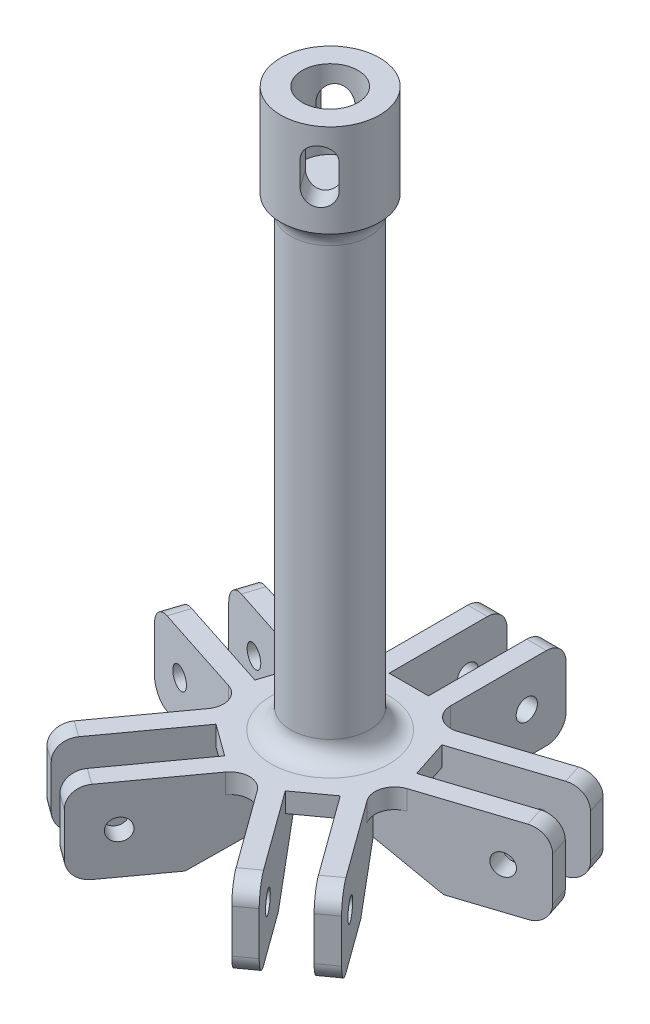
from build123d import *

# Parameters (mm, degrees)
BOSS_EXTRUDE1_DEPTH     = 3.175
SKETCH2_W               = 3.175
SKETCH2_H               = 13.97
BOSS_EXTRUDE2_DEPTH     = 10.16
FILLET1_R               = 3.175
SKETCH3_R               = 6.35
BOSS_EXTRUDE3_DEPTH     = 90
SKETCH4_R               = 1.7145
CUT_EXTRUDE1_DEPTH      = 106.700200906
CIRPATTERN2_COUNT       = 5
SKETCH5_R               = 4.5
CUT_EXTRUDE2_DEPTH      = 12.7
FILLET2_R               = 3.175
CHAMFER1_SIZE           = 3.175
SKETCH6_W               = 6.35
SKETCH6_H               = 5.08
CUT_EXTRUDE3_DEPTH      = 101.708584079
BOSS_EXTRUDE4_DEPTH     = 3.175
BOSS_EXTRUDE5_DEPTH     = 3.175
CIRPATTERN3_COUNT       = 5
BOSS_EXTRUDE6_START     = -15
SKETCH10_R              = 8
SKETCH10_R_2            = 6.35
BOSS_EXTRUDE6_DEPTH     = 15
FILLET3_R               = 3.175
CUT_EXTRUDE6_DEPTH      = 112.317109798
CUT_EXTRUDE6_DEPTH_BACK = 112.317109798


# Some blends are built 0.0001 mm under size
with BuildPart() as part:
    # Sketch1 → Boss-Extrude1 (new body)
    with BuildSketch(Plane(origin=(0, 0, 0), x_dir=(1, 0, 0), z_dir=(0, 1, 0))):
        with BuildLine():
            Line((3.175, 17.78), (-3.175, 17.78))
            Line((-3.175, 17.78), (-3.175, 31.75))
            Line((-3.175, 31.75), (-6.35, 31.75))
            Line((-6.35, 31.75), (-6.35, 17.78))
            Line((-6.35, 17.78), (-6.35, 17.48005039))
            Line((-6.35, 17.48005039), (-6.35, 13.110037792))
            ThreePointArc((-6.35, 13.110037792), (-7.658781824, 10.541408835), (-10.506128957, 10.090433353))
            Line((-10.506128957, 10.090433353), (-14.662257914, 11.440841512))
            Line((-14.662257914, 11.440841512), (-18.571052273, 12.710885787))
            Line((-18.571052273, 12.710885787), (-28.233786478, 15.85049845))
            Line((-28.233786478, 15.85049845), (-29.214915435, 12.830894011))
            Line((-29.214915435, 12.830894011), (-15.928655903, 8.513926599))
            Line((-15.928655903, 8.513926599), (-17.890913817, 2.474717721))
            Line((-17.890913817, 2.474717721), (-31.17717335, 6.791685132))
            Line((-31.17717335, 6.791685132), (-32.158302307, 3.772080693))
            Line((-32.158302307, 3.772080693), (-20.07988455, -0.152435136))
            Line((-20.07988455, -0.152435136), (-18.586773743, -0.637576245))
            Line((-18.586773743, -0.637576245), (-14.430644786, -1.987984404))
            ThreePointArc((-14.430644786, -1.987984404), (-12.392169304, -4.026459886), (-12.843144786, -6.873807019))
            Line((-12.843144786, -6.873807019), (-15.411773743, -10.409221476))
            Line((-15.411773743, -10.409221476), (-17.827541511, -13.734240556))
            Line((-17.827541511, -13.734240556), (-23.799439675, -21.953853219))
            Line((-23.799439675, -21.953853219), (-21.230810717, -23.820071395))
            Line((-21.230810717, -23.820071395), (-13.019450743, -12.518103984))
            Line((-13.019450743, -12.518103984), (-7.882192829, -16.250540336))
            Line((-7.882192829, -16.250540336), (-16.093552803, -27.552507747))
            Line((-16.093552803, -27.552507747), (-13.524923846, -29.418725923))
            Line((-13.524923846, -29.418725923), (-6.060051142, -19.144210095))
            Line((-6.060051142, -19.144210095), (-5.137257914, -17.87409418))
            Line((-5.137257914, -17.87409418), (-2.568628957, -14.338679723))
            ThreePointArc((-2.568628957, -14.338679723), (0, -13.029897899), (2.568628957, -14.338679723))
            Line((2.568628957, -14.338679723), (5.137257914, -17.87409418))
            Line((5.137257914, -17.87409418), (7.553025683, -21.199113261))
            Line((7.553025683, -21.199113261), (13.524923846, -29.418725923))
            Line((13.524923846, -29.418725923), (16.093552803, -27.552507747))
            Line((16.093552803, -27.552507747), (7.882192829, -16.250540336))
            Line((7.882192829, -16.250540336), (13.019450743, -12.518103984))
            Line((13.019450743, -12.518103984), (21.230810717, -23.820071395))
            Line((21.230810717, -23.820071395), (23.799439675, -21.953853219))
            Line((23.799439675, -21.953853219), (16.33456697, -11.679337391))
            Line((16.33456697, -11.679337391), (15.411773743, -10.409221476))
            Line((15.411773743, -10.409221476), (12.843144786, -6.873807019))
            ThreePointArc((12.843144786, -6.873807019), (12.392169304, -4.026459886), (14.430644786, -1.987984404))
            Line((14.430644786, -1.987984404), (18.586773743, -0.637576245))
            Line((18.586773743, -0.637576245), (22.495568101, 0.63246803))
            Line((22.495568101, 0.63246803), (32.158302307, 3.772080693))
            Line((32.158302307, 3.772080693), (31.17717335, 6.791685132))
            Line((31.17717335, 6.791685132), (17.890913817, 2.474717721))
            Line((17.890913817, 2.474717721), (15.928655903, 8.513926599))
            Line((15.928655903, 8.513926599), (29.214915435, 12.830894011))
            Line((29.214915435, 12.830894011), (28.233786478, 15.85049845))
            Line((28.233786478, 15.85049845), (16.155368721, 11.925982621))
            Line((16.155368721, 11.925982621), (14.662257914, 11.440841512))
            Line((14.662257914, 11.440841512), (10.506128957, 10.090433353))
            ThreePointArc((10.506128957, 10.090433353), (7.658781824, 10.541408835), (6.35, 13.110037792))
            Line((6.35, 13.110037792), (6.35, 17.48005039))
            Line((6.35, 17.48005039), (6.35, 21.59))
            Line((6.35, 21.59), (6.35, 31.75))
            Line((6.35, 31.75), (3.175, 31.75))
            Line((3.175, 31.75), (3.175, 17.78))
        make_face()
    extrude(amount=BOSS_EXTRUDE1_DEPTH)

    # Sketch2 → Boss-Extrude2 (add)
    with BuildSketch(Plane.XZ):
        Polygon((-28.233786478, -15.85049845), (-29.214915435, -12.830894011), (-15.928655903, -8.513926599), (-14.947526945, -11.533531038), align=None)
        Polygon((-23.799439675, 21.953853219), (-21.230810717, 23.820071395), (-13.019450743, 12.518103984), (-15.5880797, 10.651885808), align=None)
        Polygon((-13.524923846, 29.418725923), (-16.093552803, 27.552507747), (-7.882192829, 16.250540336), (-5.313563871, 18.116758512), align=None)
        Polygon((13.524923846, 29.418725923), (16.093552803, 27.552507747), (7.882192829, 16.250540336), (5.313563871, 18.116758512), align=None)
        Polygon((-32.158302307, -3.772080693), (-31.17717335, -6.791685132), (-17.890913817, -2.474717721), (-18.872042774, 0.544886718), align=None)
        Polygon((23.799439675, 21.953853219), (21.230810717, 23.820071395), (13.019450743, 12.518103984), (15.5880797, 10.651885808), align=None)
        Polygon((32.158302307, -3.772080693), (31.17717335, -6.791685132), (17.890913817, -2.474717721), (18.872042774, 0.544886718), align=None)
        Polygon((28.233786478, -15.85049845), (29.214915435, -12.830894011), (15.928655903, -8.513926599), (14.947526945, -11.533531038), align=None)
        with Locations((4.7625, -24.765)):
            Rectangle(SKETCH2_W, SKETCH2_H)
        with Locations((-4.7625, -24.765)):
            Rectangle(SKETCH2_W, SKETCH2_H)
    extrude(amount=BOSS_EXTRUDE2_DEPTH)

    # Fillet1
    fillet1_edges = [part.edges().sort_by_distance(p)[0] for p in [
        (22.515125196, 3.175, 22.886962307),
        (31.667737828, 3.175, -5.281882913),
        (-22.515125196, -10.16, 22.886962307),
        (28.724350957, 3.175, -14.34069623),
        (-28.724350957, -10.16, -14.34069623),
        (-14.809238325, -10.16, 28.485616835),
        (-28.724350957, 3.175, -14.34069623),
        (4.7625, 3.175, -31.75),
        (-31.667737828, -10.16, -5.281882913),
        (14.809238325, -10.16, 28.485616835),
        (-4.7625, 3.175, -31.75),
        (22.515125196, -10.16, 22.886962307),
        (31.667737828, -10.16, -5.281882913),
        (28.724350957, -10.16, -14.34069623),
        (4.7625, -10.16, -31.75),
        (-4.7625, -10.16, -31.75),
        (-31.667737828, 3.175, -5.281882913),
        (-22.515125196, 3.175, 22.886962307),
        (-14.809238325, 3.175, 28.485616835),
        (14.809238325, 3.175, 28.485616835),
    ]]
    fillet(fillet1_edges, radius=FILLET1_R)

    # Sketch3 → Boss-Extrude3 (add)
    with BuildSketch(Plane(origin=(0, 3.175, 0), x_dir=(1, 0, 0), z_dir=(0, 1, 0))):
        with Locations(Location((0, 0, 0), (0, 0, 90))):
            Circle(SKETCH3_R)
    extrude(amount=BOSS_EXTRUDE3_DEPTH)

    # Sketch4 → Cut-Extrude1 (cut, symmetric)
    with BuildSketch(Plane.ZY.offset(6.35)):
        with Locations(Location((-25.4, -3.4925, 0), (0, 0, 180))):
            Circle(SKETCH4_R)
    cut_extrude1 = extrude(amount=CUT_EXTRUDE1_DEPTH, both=True, mode=Mode.SUBTRACT)

    # CirPattern2: Cut-Extrude1 ×5 about axis
    cirpattern2_axis = Axis((0, 93.175, 0), (0, -1, 0))
    for i in range(1, CIRPATTERN2_COUNT):
        add(cut_extrude1.rotate(cirpattern2_axis, i * 360 / CIRPATTERN2_COUNT), mode=Mode.SUBTRACT)

    # Sketch5 → Cut-Extrude2 (cut)
    with BuildSketch(Plane(origin=(0, 93.175, 0), x_dir=(1, 0, 0), z_dir=(0, 1, 0))):
        with Locations(Location((0, 0, 0), (0, 0, 270))):
            Circle(SKETCH5_R)
    extrude(amount=-CUT_EXTRUDE2_DEPTH, mode=Mode.SUBTRACT)

    # Fillet2
    fillet2_edges = [part.edges().sort_by_distance(p)[0] for p in [
        (0, 3.175, 6.35),
    ]]
    fillet(fillet2_edges, radius=FILLET2_R)

    # Chamfer1
    chamfer1_edges = [part.edges().sort_by_distance(p)[0] for p in [
        (0, 3.175, -17.78),
    ]]
    chamfer(chamfer1_edges, length=CHAMFER1_SIZE - 0.0001)  # a hair under: the kernel refuses the full size

    # Sketch6 → Cut-Extrude3 (cut, through all)
    with BuildSketch(Plane(origin=(0, 3.175, 0), x_dir=(1, 0, 0), z_dir=(0, 1, 0))):
        Polygon((17.890913817, 2.474717721), (15.928655903, 8.513926599), (11.0972888, 6.944120268), (13.059546714, 0.904911389), align=None)
        with Locations((0, 15.24)):
            Rectangle(SKETCH6_W, SKETCH6_H)
        Polygon((7.882192829, -16.250540336), (13.019450743, -12.518103984), (10.033501661, -8.408297653), (4.896243747, -12.140734005), align=None)
        Polygon((-13.019450743, -12.518103984), (-7.882192829, -16.250540336), (-4.896243747, -12.140734005), (-10.033501661, -8.408297653), align=None)
        Polygon((-15.928655903, 8.513926599), (-17.890913817, 2.474717721), (-13.059546714, 0.904911389), (-11.0972888, 6.944120268), align=None)
    extrude(amount=-CUT_EXTRUDE3_DEPTH, mode=Mode.SUBTRACT)

    # Sketch7 → Boss-Extrude4 (add)
    with BuildSketch(Plane(origin=(5.137257914, 0, -3.732436352), x_dir=(-0.587785252292474, 0, -0.8090169943749469), z_dir=(0.8090169943749469, 0, -0.587785252292474))):
        Polygon((-17.78, -10.16), (0, 0), (-17.78, 0), align=None)
    boss_extrude4 = extrude(amount=-BOSS_EXTRUDE4_DEPTH)

    # Sketch8 → Boss-Extrude5 (add)
    with BuildSketch(Plane(origin=(-5.137257914, 0, 3.732436352), x_dir=(0.5877852522924727, 0, 0.8090169943749478), z_dir=(-0.8090169943749478, 0, 0.5877852522924727))):
        Polygon((17.78, -10.16), (0, 0), (17.78, 0), align=None)
    boss_extrude5 = extrude(amount=-BOSS_EXTRUDE5_DEPTH)

    # CirPattern3: Boss-Extrude4, Boss-Extrude5 ×5 about axis
    cirpattern3_axis = Axis((0, 0, 0), (0, 1, 0))
    add([boss_extrude4.rotate(cirpattern3_axis, i * 360 / CIRPATTERN3_COUNT) for i in range(1, CIRPATTERN3_COUNT)])
    add([boss_extrude5.rotate(cirpattern3_axis, i * 360 / CIRPATTERN3_COUNT) for i in range(1, CIRPATTERN3_COUNT)])

    # Sketch10 → Boss-Extrude6 (add)
    with BuildSketch(Plane(origin=(0, 93.175, 0), x_dir=(1, 0, 0), z_dir=(0, 1, 0)).offset(BOSS_EXTRUDE6_START)):
        with Locations(Location((0, 0, 0), (0, 0, 270))):
            Circle(SKETCH10_R)
        with Locations(Location((0, 0, 0), (0, 0, 90))):
            Circle(SKETCH10_R_2, mode=Mode.SUBTRACT)
    extrude(amount=BOSS_EXTRUDE6_DEPTH)

    # Fillet3
    # the kernel refuses this fillet: 3.175 mm, written as the material it adds along each edge
    with BuildSketch(Plane(origin=(0, 78.175, 0), x_dir=(0, 0, -1), z_dir=(1, 0, 0))) as fillet3_piece_1:
        with BuildLine():
            CenterArc((9.525, -2.784780063), FILLET3_R, 118.705974608, 61.294025392)
            Line((8, 0), (7.9695, 0.055695601))
            ThreePointArc((7.9695, 0.055695601), (7.175, 0.0635), (6.35, 0.0635))
            Line((6.35, 0.0635), (6.2865, 0))
            Line((6.2865, 0), (6.2865, -2.784780063))
            Line((6.2865, -2.784780063), (6.35, -2.784780063))
        make_face()
    revolve(axis=Axis((0, 78.175, 0), (0, 1, 0)))

    # Sketch14 → Cut-Extrude6 (cut, two sides: drawn at the far end of the back side and taken through both)
    with BuildSketch(Plane(origin=(9.33109088, 0, 12.843144786), x_dir=(0.8090169943749472, 0, -0.5877852522924736), z_dir=(0.5877852522924736, 0, 0.8090169943749472)).offset(-CUT_EXTRUDE6_DEPTH_BACK)):
        with BuildLine():
            Line((2.25, 88.175), (2.25, 84.075))
            ThreePointArc((2.25, 84.075), (0, 81.825), (-2.25, 84.075))
            Line((-2.25, 84.075), (-2.25, 88.175))
            ThreePointArc((-2.25, 88.175), (0, 90.425), (2.25, 88.175))
        make_face()
    extrude(amount=CUT_EXTRUDE6_DEPTH + CUT_EXTRUDE6_DEPTH_BACK, mode=Mode.SUBTRACT)


solid = part.part
